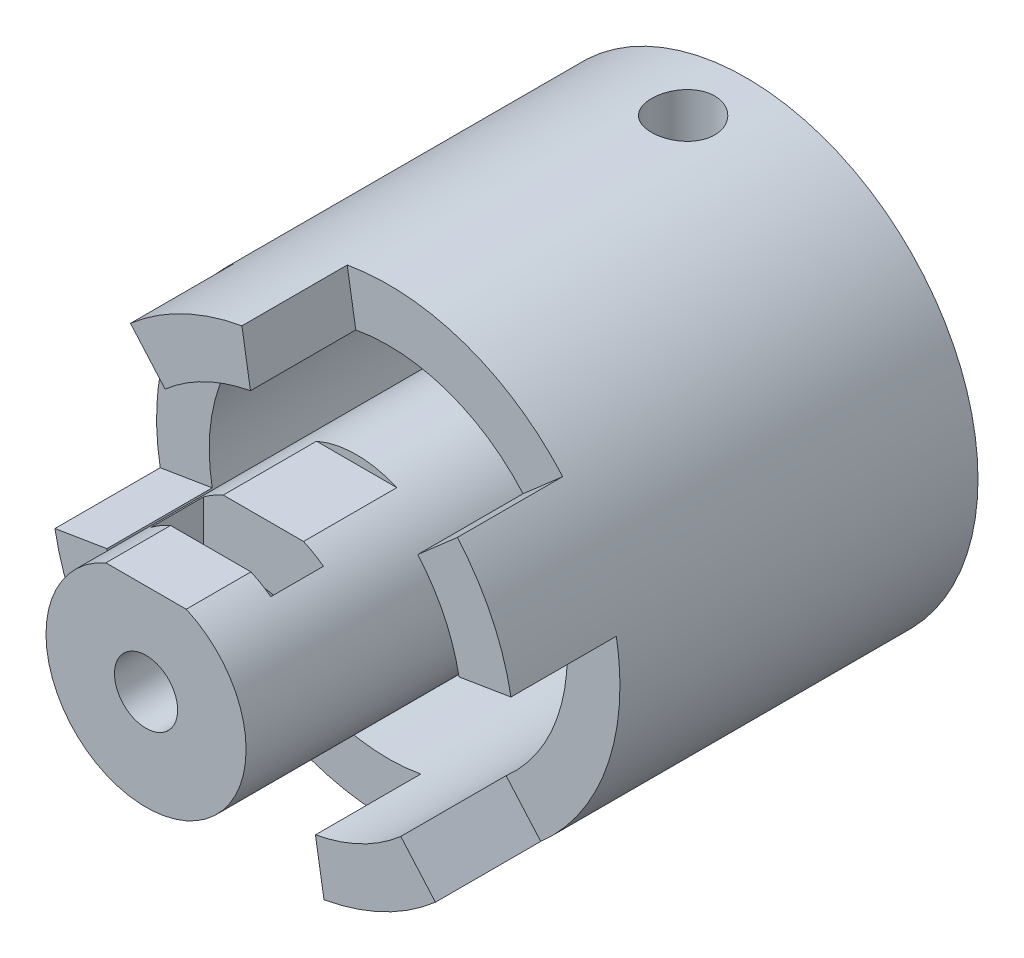
from build123d import *
from build123d.topology import SkipClean

# Parameters (mm, degrees)
BOSS_EXTRUDE2_DEPTH = 5
CIRPATTERN1_COUNT   = 4
SKETCH5_R           = 1.5
CUT_EXTRUDE1_DEPTH  = 10
CUT_EXTRUDE2_DEPTH  = 10
SKETCH8_W           = 5.65
SKETCH8_H           = 2.5
CUT_EXTRUDE3_DEPTH  = 6.5
SKETCH10_R          = 1.5
CUT_EXTRUDE5_DEPTH  = 10
CUT_EXTRUDE6_START  = -10
CUT_EXTRUDE6_DEPTH  = 10
SKETCH13_W          = 5.7
SKETCH13_H          = 2.5
CUT_EXTRUDE7_DEPTH  = 7.5


with BuildPart() as part:
    # Sketch3 → Revolve1 (revolve)
    with BuildSketch(Plane(origin=(0, 0, 0), x_dir=(0, 0, -1), z_dir=(1, 0, 0))):
        Polygon((-7.337359925, 0), (14.162640075, 0), (14.162640075, -3.75), (4.162640075, -3.75), (4.162640075, -6.25), (16.162640075, -6.25), (21.162640075, -6.25), (21.162640075, -3.047373414), (21.162640075, 4.75), (19.162640075, 4.75), (-7.337359925, 4.75), align=None)
    revolve(axis=Axis((0, 4.75, 26.894611834), (0, 0, -1)))

    # Sketch4 → Boss-Extrude2 (add)
    with BuildSketch(Plane.XY.offset(-4.162640075)):
        with BuildLine():
            Line((-1.948133817, 15.576115399), (-1.542950524, 13.108786017))
            ThreePointArc((-1.542950524, 13.108786017), (-3.700532064, 12.402193309), (-5.594111688, 11.149680807))
            Line((-5.594111688, 11.149680807), (-7.239438655, 13.031939867))
            ThreePointArc((-7.239438655, 13.031939867), (-4.766663326, 14.663572552), (-1.948133817, 15.576115399))
        make_face()
    boss_extrude2 = extrude(amount=BOSS_EXTRUDE2_DEPTH)

    # CirPattern1: Boss-Extrude2 ×4 about axis
    with SkipClean():  # the faces are left unmerged after this step: merging them gives an invalid solid
        cirpattern1_axis = Axis((0, 4.75, 7.337359925), (0, 0, 1))
        for i in range(1, CIRPATTERN1_COUNT):
            add(boss_extrude2.rotate(cirpattern1_axis, i * 360 / CIRPATTERN1_COUNT))

    # Sketch5 → Cut-Extrude1 (cut)
    with SkipClean():  # the faces are left unmerged after this step: merging them gives an invalid solid
        with BuildSketch(Plane.XY.offset(7.337359925)):
            with Locations((0, 4.75)):
                Circle(SKETCH5_R)
        extrude(amount=-CUT_EXTRUDE1_DEPTH, mode=Mode.SUBTRACT)

    # Sketch7 → Cut-Extrude2 (cut)
    with SkipClean():  # the faces are left unmerged after this step: merging them gives an invalid solid
        with BuildSketch(Plane(origin=(0, 0, -21.162640075), x_dir=(-1, 0, 0), z_dir=(0, 0, -1))):
            with BuildLine():
                Line((-1.445, 6.273802809), (1.445, 6.273802809))
                ThreePointArc((1.445, 6.273802809), (0, 2.65), (-1.445, 6.273802809))
            make_face()
        extrude(amount=-CUT_EXTRUDE2_DEPTH, mode=Mode.SUBTRACT)

    # Sketch8 → Cut-Extrude3 (cut)
    with SkipClean():  # the faces are left unmerged after this step: merging them gives an invalid solid
        with BuildSketch(Plane(origin=(0, 0, -21.162640075), x_dir=(-1, 0, 0), z_dir=(0, 0, -1))):
            with Locations((0, 8.523802809)):
                Rectangle(SKETCH8_W, SKETCH8_H)
        extrude(amount=-CUT_EXTRUDE3_DEPTH, mode=Mode.SUBTRACT)

    # Sketch10 → Cut-Extrude5 (cut)
    with SkipClean():  # the faces are left unmerged after this step: merging them gives an invalid solid
        with BuildSketch(Plane.XZ.offset(-6.273802809)):
            with Locations((0, -18.162640075)):
                Circle(SKETCH10_R)
        extrude(amount=-CUT_EXTRUDE5_DEPTH, mode=Mode.SUBTRACT)

    # Sketch12 → Cut-Extrude6 (cut)
    with SkipClean():  # the faces are left unmerged after this step: merging them gives an invalid solid
        with BuildSketch(Plane.XY.offset(7.337359925).offset(CUT_EXTRUDE6_START)):
            with BuildLine():
                Line((-1.907535842, 9.100150229), (1.907535842, 9.100150229))
                ThreePointArc((1.907535842, 9.100150229), (0, 9.5), (-1.907535842, 9.100150229))
            make_face()
        extrude(amount=CUT_EXTRUDE6_DEPTH, mode=Mode.SUBTRACT)

    # Sketch13 → Cut-Extrude7 (cut)
    with SkipClean():  # the faces are left unmerged after this step: merging them gives an invalid solid
        with BuildSketch(Plane(origin=(0, 9.100150229, 0), x_dir=(1, 0, 0), z_dir=(0, 1, 0))):
            with Locations((0, -3.015381777)):
                Rectangle(SKETCH13_W, SKETCH13_H)
        extrude(amount=-CUT_EXTRUDE7_DEPTH, mode=Mode.SUBTRACT)


solid = part.part
